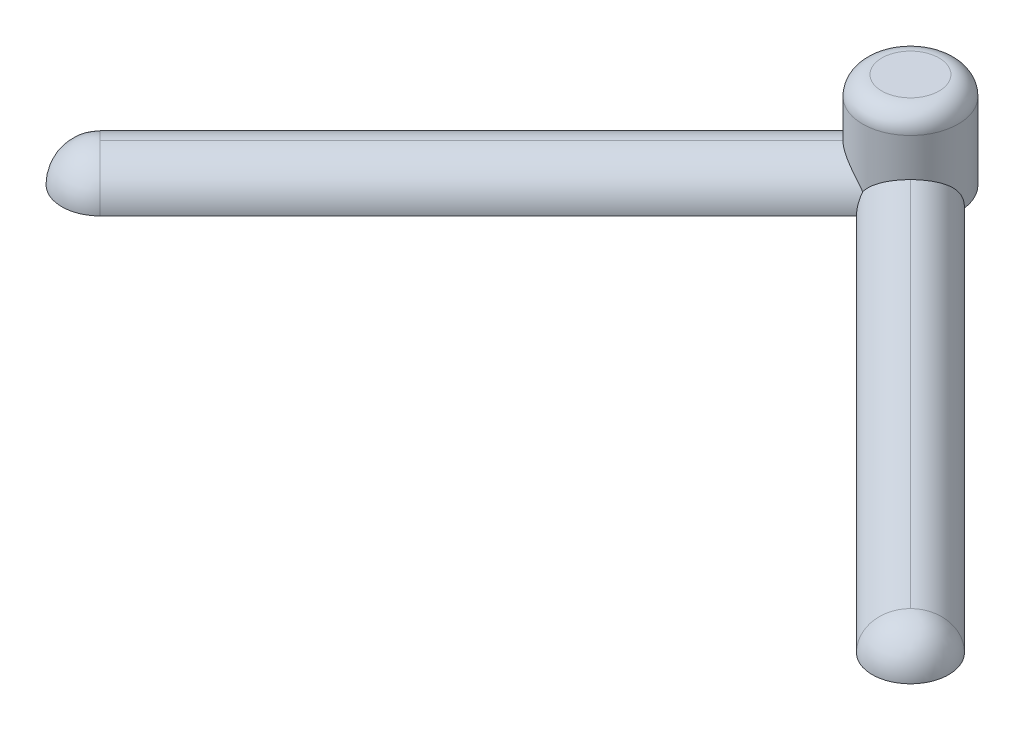
from build123d import *

# Parameters (mm, degrees)
BOSS_EXTRUDE1_DEPTH = 2.54
FILLET4_R           = 2.54
SKETCH2_R           = 3.175
BOSS_EXTRUDE2_DEPTH = 6.35
FILLET5_R           = 1.27
SCALE1_SCALE        = 2


with BuildPart() as part:
    # Sketch1 → Boss-Extrude1 (new body)
    with BuildSketch(Plane(origin=(0, 0, 0), x_dir=(1, 0, 0), z_dir=(0, 1, 0))):
        with BuildLine():
            ThreePointArc((1.796051224, -1.796051224), (2.54, 0), (1.796051224, 1.796051224))
            ThreePointArc((1.796051224, 1.796051224), (0, 2.54), (-1.796051224, 1.796051224))
            ThreePointArc((-1.796051224, 1.796051224), (-2.54, 0), (-1.796051224, -1.796051224))
            Line((-1.796051224, -1.796051224), (0, -3.592102448))
            Line((0, -3.592102448), (1.796051224, -1.796051224))
        make_face()
        with BuildLine():
            Line((28.736819587, -25.144717139), (1.796051224, 1.796051224))
            ThreePointArc((1.796051224, 1.796051224), (2.54, 0), (1.796051224, -1.796051224))
            Line((1.796051224, -1.796051224), (0, -3.592102448))
            Line((0, -3.592102448), (25.144717139, -28.736819587))
            ThreePointArc((25.144717139, -28.736819587), (28.736819587, -28.736819587), (28.736819587, -25.144717139))
        make_face()
        with BuildLine():
            ThreePointArc((-1.796051224, -1.796051224), (-2.54, 0), (-1.796051224, 1.796051224))
            Line((-1.796051224, 1.796051224), (-28.736819587, -25.144717139))
            ThreePointArc((-28.736819587, -25.144717139), (-28.736819587, -28.736819587), (-25.144717139, -28.736819587))
            Line((-25.144717139, -28.736819587), (0, -3.592102448))
            Line((0, -3.592102448), (-1.796051224, -1.796051224))
        make_face()
    extrude(amount=BOSS_EXTRUDE1_DEPTH)

    # Fillet4
    fillet4_edges = [part.edges().sort_by_distance(p)[0] for p in [
        (-28.736819587, 2.54, 28.736819587),
        (-15.266435406, 2.54, 11.674332957),
        (0, 2.54, -2.54),
        (15.266435406, 2.54, 11.674332957),
        (28.736819587, 2.54, 28.736819587),
        (12.572358569, 2.54, 16.164461018),
        (-12.572358569, 2.54, 16.164461018),
    ]]
    fillet(fillet4_edges, radius=FILLET4_R - 0.0001)  # a hair under: the kernel refuses the full size

    # Sketch2 → Boss-Extrude2 (add)
    with BuildSketch(Plane(origin=(0, 0, 0), x_dir=(1, 0, 0), z_dir=(0, 1, 0))):
        with Locations(Location((0, 0, 0), (0, 0, 171.869897646))):
            Circle(SKETCH2_R)
    extrude(amount=BOSS_EXTRUDE2_DEPTH)

    # Fillet5
    fillet5_edges = [part.edges().sort_by_distance(p)[0] for p in [
        (3.143089642, 6.35, 0.449012806),
    ]]
    fillet(fillet5_edges, radius=FILLET5_R)


with BuildPart() as part_1:
    # Scale1: scaled about (-2.1e-08, 1.486347435, 11.976765816)
    add(part.part.scale(SCALE1_SCALE).moved(Location((2.1e-08, -1.486347435, -11.976765816))))


solid = part_1.part
